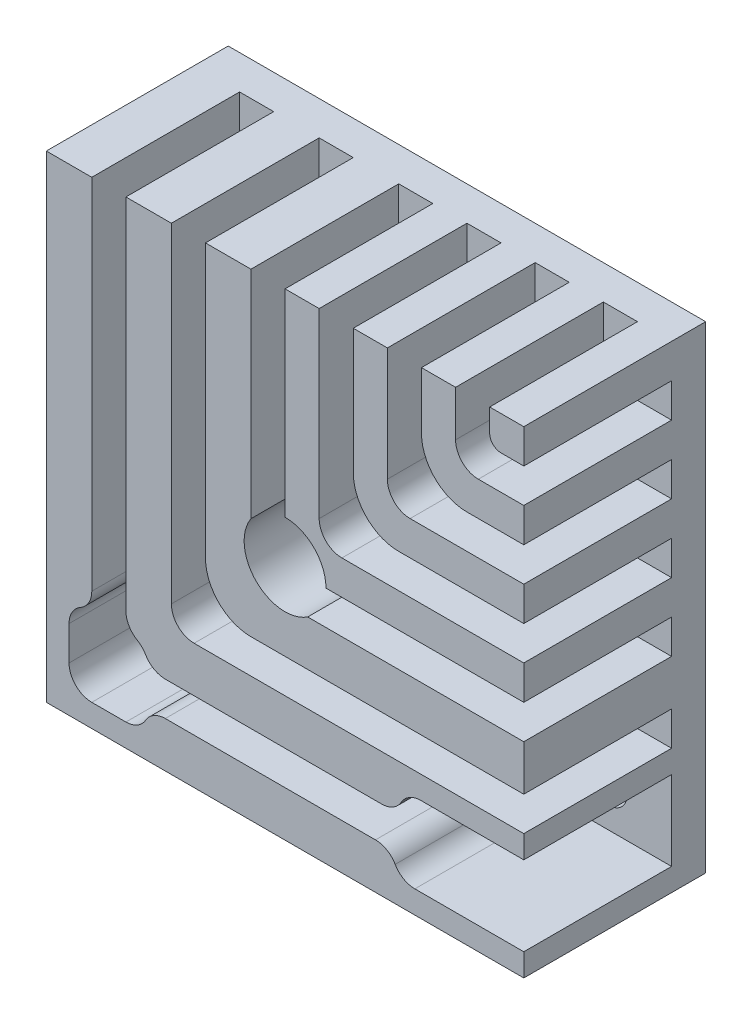
from build123d import *

# Parameters (mm, degrees)
SKETCH1_W           = 42
SKETCH1_H           = 42
BOSS_EXTRUDE1_DEPTH = 16
CUT_EXTRUDE2_DEPTH  = 13
FILLET2_R           = 1
FILLET3_R           = 4
FILLET4_R           = 4
FILLET6_R           = 4
FILLET8_R           = 2
FILLET9_R           = 2
FILLET11_R          = 2
FILLET12_R          = 2
FILLET13_R          = 2
CUT_EXTRUDE3_REACH  = 63.514
SKETCH4_R           = 1.6
SKETCH4_R_2         = 3.6
SKETCH5_W           = 11.093459678
SKETCH5_H           = 7
SKETCH5_W_2         = 7
CUT_EXTRUDE14_DEPTH = 13
FILLET14_R          = 2
FILLET15_R          = 2
FILLET16_R          = 2
FILLET17_R          = 2
FILLET18_R          = 2
FILLET19_R          = 2
FILLET20_R          = 2
FILLET21_R          = 2
FILLET22_R          = 2
FILLET23_R          = 2
FILLET24_R          = 2
FILLET25_R          = 2
FILLET26_R          = 2


with BuildPart() as part:
    # Sketch1 → Boss-Extrude1 (new body)
    with BuildSketch(Plane.XY):
        with Locations((21, 21)):
            Rectangle(SKETCH1_W, SKETCH1_H)
    extrude(amount=BOSS_EXTRUDE1_DEPTH)

    # Sketch3 → Cut-Extrude2 (cut)
    with BuildSketch(Plane.XY.offset(16)):
        Polygon((39, 42), (39, 39), (42, 39), (42, 36), (36, 36), (36, 42), align=None)
        Polygon((33, 42), (33, 33), (42, 33), (42, 30), (30, 30), (30, 42), align=None)
        Polygon((42, 27), (27, 27), (27, 42), (24, 42), (24, 24), (42, 24), align=None)
        Polygon((42, 21), (21, 21), (21, 42), (18, 42), (18, 18), (42, 18), align=None)
        Polygon((42, 14), (14, 14), (14, 42), (11, 42), (11, 11), (42, 11), align=None)
        Polygon((42, 7), (7, 7), (7, 42), (4, 42), (4, 4), (42, 4), align=None)
    extrude(amount=-CUT_EXTRUDE2_DEPTH, mode=Mode.SUBTRACT)

    # Fillet2
    fillet2_edges = [part.edges().sort_by_distance(p)[0] for p in [
        (39, 39, 9.5),
    ]]
    fillet(fillet2_edges, radius=FILLET2_R)

    # Fillet3
    fillet3_edges = [part.edges().sort_by_distance(p)[0] for p in [
        (33, 33, 9.5),
    ]]
    fillet(fillet3_edges, radius=FILLET3_R)

    # Fillet4
    fillet4_edges = [part.edges().sort_by_distance(p)[0] for p in [
        (27, 27, 9.5),
    ]]
    fillet(fillet4_edges, radius=FILLET4_R)

    # Fillet6
    fillet6_edges = [part.edges().sort_by_distance(p)[0] for p in [
        (14, 14, 9.5),
    ]]
    fillet(fillet6_edges, radius=FILLET6_R)

    # Fillet8
    fillet8_edges = [part.edges().sort_by_distance(p)[0] for p in [
        (36, 36, 9.5),
    ]]
    fillet(fillet8_edges, radius=FILLET8_R)

    # Fillet9
    fillet9_edges = [part.edges().sort_by_distance(p)[0] for p in [
        (30, 30, 9.5),
    ]]
    fillet(fillet9_edges, radius=FILLET9_R)

    # Fillet11
    fillet11_edges = [part.edges().sort_by_distance(p)[0] for p in [
        (18, 18, 9.5),
    ]]
    fillet(fillet11_edges, radius=FILLET11_R)

    # Fillet12
    fillet12_edges = [part.edges().sort_by_distance(p)[0] for p in [
        (11, 11, 9.5),
    ]]
    fillet(fillet12_edges, radius=FILLET12_R)

    # Fillet13
    fillet13_edges = [part.edges().sort_by_distance(p)[0] for p in [
        (4, 4, 9.5),
    ]]
    fillet(fillet13_edges, radius=FILLET13_R)

    # Sketch4 → Cut-Extrude3 (cut, up to next)
    with BuildSketch(Plane(origin=(0, 0, 0), x_dir=(-1, 0, 0), z_dir=(0, 0, -1)), mode=Mode.PRIVATE) as cut_extrude3_sk1:
        with Locations((-36.5, 5.5)):
            Circle(SKETCH4_R)
    cut_extrude3_tool1 = extrude(cut_extrude3_sk1.sketch, amount=-CUT_EXTRUDE3_REACH, mode=Mode.PRIVATE) & part.part
    # Sketch4 → Cut-Extrude3 (cut, up to next)
    with BuildSketch(Plane(origin=(0, 0, 0), x_dir=(-1, 0, 0), z_dir=(0, 0, -1)), mode=Mode.PRIVATE) as cut_extrude3_sk2:
        with Locations((-5.5, 5.5)):
            Circle(SKETCH4_R)
    cut_extrude3_tool2 = extrude(cut_extrude3_sk2.sketch, amount=-CUT_EXTRUDE3_REACH, mode=Mode.PRIVATE) & part.part
    # Sketch4 → Cut-Extrude3 (cut, up to next)
    with BuildSketch(Plane(origin=(0, 0, 0), x_dir=(-1, 0, 0), z_dir=(0, 0, -1)), mode=Mode.PRIVATE) as cut_extrude3_sk3:
        with Locations((-21, 21)):
            Circle(SKETCH4_R_2)
    cut_extrude3_tool3 = extrude(cut_extrude3_sk3.sketch, amount=-CUT_EXTRUDE3_REACH, mode=Mode.PRIVATE) & part.part
    add(cut_extrude3_tool1.solids().sort_by_distance((36.5, 5.5, 0))[0], mode=Mode.SUBTRACT)
    add(cut_extrude3_tool2.solids().sort_by_distance((5.5, 5.5, 0))[0], mode=Mode.SUBTRACT)
    add(cut_extrude3_tool3.solids().sort_by_distance((21, 21, 0))[0], mode=Mode.SUBTRACT)

    # Sketch5 → Cut-Extrude14 (cut)
    with BuildSketch(Plane.XY.offset(16)):
        with Locations((36.5, 5.5)):
            Rectangle(SKETCH5_W, SKETCH5_H)
        with Locations((5.5, 5.5)):
            Rectangle(SKETCH5_W_2, SKETCH5_H)
    extrude(amount=-CUT_EXTRUDE14_DEPTH, mode=Mode.SUBTRACT)

    # Fillet14
    fillet14_edges = [part.edges().sort_by_distance(p)[0] for p in [
        (24, 24, 9.5),
    ]]
    fillet(fillet14_edges, radius=FILLET14_R)

    # Fillet15
    fillet15_edges = [part.edges().sort_by_distance(p)[0] for p in [
        (9, 2, 9.5),
    ]]
    fillet(fillet15_edges, radius=FILLET15_R - 0.0001)  # a hair under: the kernel refuses the full size

    # Fillet16
    fillet16_edges = [part.edges().sort_by_distance(p)[0] for p in [
        (2, 2, 9.5),
    ]]
    fillet(fillet16_edges, radius=FILLET16_R)

    # Fillet17
    fillet17_edges = [part.edges().sort_by_distance(p)[0] for p in [
        (2, 9, 9.5),
    ]]
    fillet(fillet17_edges, radius=FILLET17_R - 0.0001)  # a hair under: the kernel refuses the full size

    # Fillet18
    fillet18_edges = [part.edges().sort_by_distance(p)[0] for p in [
        (9, 9, 9.5),
    ]]
    fillet(fillet18_edges, radius=FILLET18_R - 0.0001)  # a hair under: the kernel refuses the full size

    # Fillet19
    fillet19_edges = [part.edges().sort_by_distance(p)[0] for p in [
        (4, 9, 9.5),
    ]]
    fillet(fillet19_edges, radius=FILLET19_R)

    # Fillet20
    fillet20_edges = [part.edges().sort_by_distance(p)[0] for p in [
        (7, 9, 9.5),
    ]]
    fillet(fillet20_edges, radius=FILLET20_R)

    # Fillet21
    fillet21_edges = [part.edges().sort_by_distance(p)[0] for p in [
        (9, 7, 9.5),
    ]]
    fillet(fillet21_edges, radius=FILLET21_R)

    # Fillet22
    fillet22_edges = [part.edges().sort_by_distance(p)[0] for p in [
        (9, 4, 9.5),
    ]]
    fillet(fillet22_edges, radius=FILLET22_R)

    # Fillet23
    fillet23_edges = [part.edges().sort_by_distance(p)[0] for p in [
        (30.953270161, 9, 9.5),
    ]]
    fillet(fillet23_edges, radius=FILLET23_R - 0.0001)  # a hair under: the kernel refuses the full size

    # Fillet24
    fillet24_edges = [part.edges().sort_by_distance(p)[0] for p in [
        (30.953270161, 7, 9.5),
    ]]
    fillet(fillet24_edges, radius=FILLET24_R)

    # Fillet25
    fillet25_edges = [part.edges().sort_by_distance(p)[0] for p in [
        (30.953270161, 4, 9.5),
    ]]
    fillet(fillet25_edges, radius=FILLET25_R - 0.0001)  # a hair under: the kernel refuses the full size

    # Fillet26
    fillet26_edges = [part.edges().sort_by_distance(p)[0] for p in [
        (30.953270161, 2, 9.5),
    ]]
    fillet(fillet26_edges, radius=FILLET26_R)


solid = part.part
